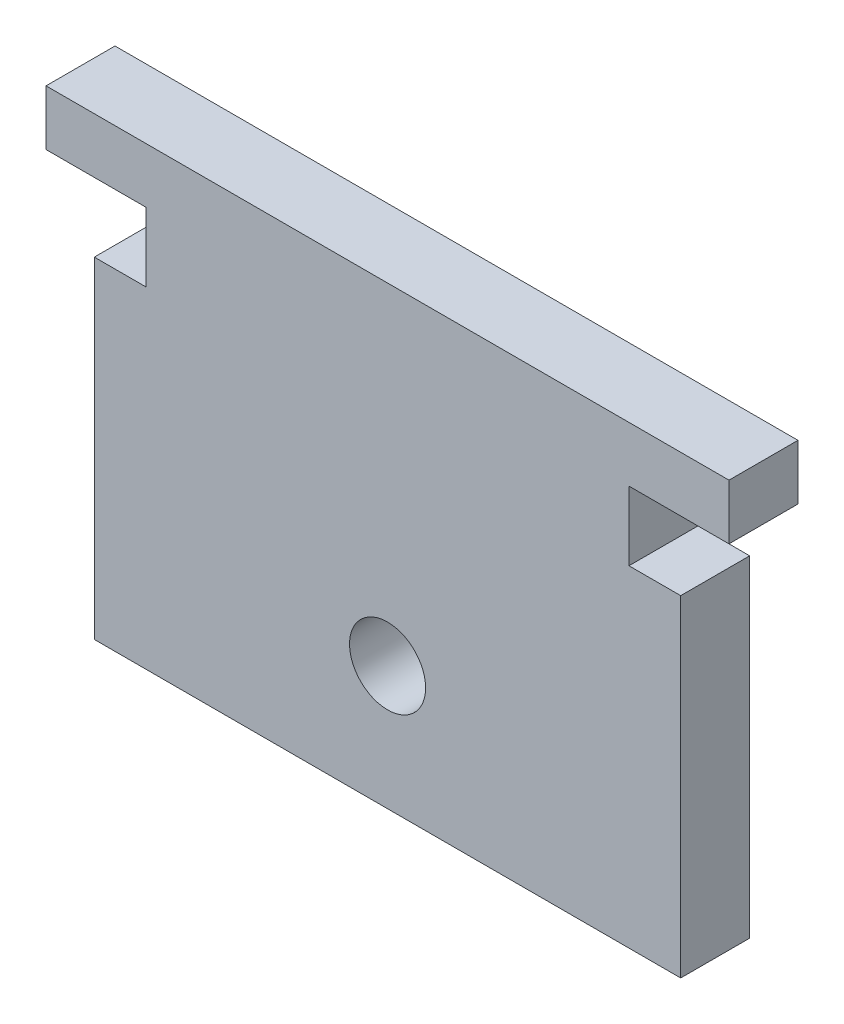
from build123d import *

# Parameters (mm, degrees)
SKETCH1_W           = 85.725
SKETCH1_H           = 50.8
BOSS_EXTRUDE1_DEPTH = 6.35
SKETCH2_W           = 15.875
SKETCH2_H           = 43.18
CUT_EXTRUDE1_DEPTH  = 6.35
SKETCH3_W           = 85.725
SKETCH3_H           = 6.35
CUT_EXTRUDE2_DEPTH  = 2.54
SKETCH5_W           = 6.35
SKETCH5_H           = 6.35
CUT_EXTRUDE3_DEPTH  = 4.7625
SKETCH6_R           = 3.5
CUT_EXTRUDE4_DEPTH  = 6.35
SKETCH7_W           = 6.35
SKETCH7_H           = 5.08
CUT_EXTRUDE5_DEPTH  = 11.43
SKETCH8_W           = 53.975
SKETCH8_H           = 6.35
CUT_EXTRUDE6_DEPTH  = 6.35


with BuildPart() as part:
    # Sketch1 → Boss-Extrude1 (new body)
    with BuildSketch(Plane.XY):
        Rectangle(SKETCH1_W, SKETCH1_H)
    extrude(amount=BOSS_EXTRUDE1_DEPTH)

    # Sketch2 → Cut-Extrude1 (cut)
    with BuildSketch(Plane.XY.offset(6.35)):
        with Locations((-34.925, -3.81)):
            Rectangle(SKETCH2_W, SKETCH2_H)
        with Locations((34.925, -3.81)):
            Rectangle(SKETCH2_W, SKETCH2_H)
    extrude(amount=-CUT_EXTRUDE1_DEPTH, mode=Mode.SUBTRACT)

    # Sketch3 → Cut-Extrude2 (cut)
    with BuildSketch(Plane(origin=(0, 25.4, 0), x_dir=(1, 0, 0), z_dir=(0, 1, 0))):
        with Locations((0, -3.175)):
            Rectangle(SKETCH3_W, SKETCH3_H)
    extrude(amount=-CUT_EXTRUDE2_DEPTH, mode=Mode.SUBTRACT)

    # Sketch5 → Cut-Extrude3 (cut)
    with BuildSketch(Plane.ZY.offset(26.9875)):
        with Locations((3.175, 14.605)):
            Rectangle(SKETCH5_W, SKETCH5_H)
    cut_extrude3 = extrude(amount=-CUT_EXTRUDE3_DEPTH, mode=Mode.SUBTRACT)

    # Mirror1: Cut-Extrude3 across plane
    add(cut_extrude3.mirror(Plane(origin=(0, 0, 0), x_dir=(0, 0, 1), z_dir=(1, 0, 0))), mode=Mode.SUBTRACT)

    # Sketch6 → Cut-Extrude4 (cut)
    with BuildSketch(Plane.XY.offset(6.35)):
        with Locations((0.00592, -7.666260004)):
            Circle(SKETCH6_R)
    extrude(amount=-CUT_EXTRUDE4_DEPTH, mode=Mode.SUBTRACT)

    # Sketch7 → Cut-Extrude5 (cut)
    with BuildSketch(Plane.ZY.offset(42.8625)):
        with Locations((3.175, 20.32)):
            Rectangle(SKETCH7_W, SKETCH7_H)
    cut_extrude5 = extrude(amount=-CUT_EXTRUDE5_DEPTH, mode=Mode.SUBTRACT)

    # Mirror2: Cut-Extrude5 across plane
    add(cut_extrude5.mirror(Plane(origin=(0, 0, 0), x_dir=(0, 0, 1), z_dir=(1, 0, 0))), mode=Mode.SUBTRACT)

    # Sketch8 → Cut-Extrude6 (cut)
    with BuildSketch(Plane.XZ.offset(25.4)):
        with Locations((0, 3.175)):
            Rectangle(SKETCH8_W, SKETCH8_H)
    extrude(amount=-CUT_EXTRUDE6_DEPTH, mode=Mode.SUBTRACT)


solid = part.part
